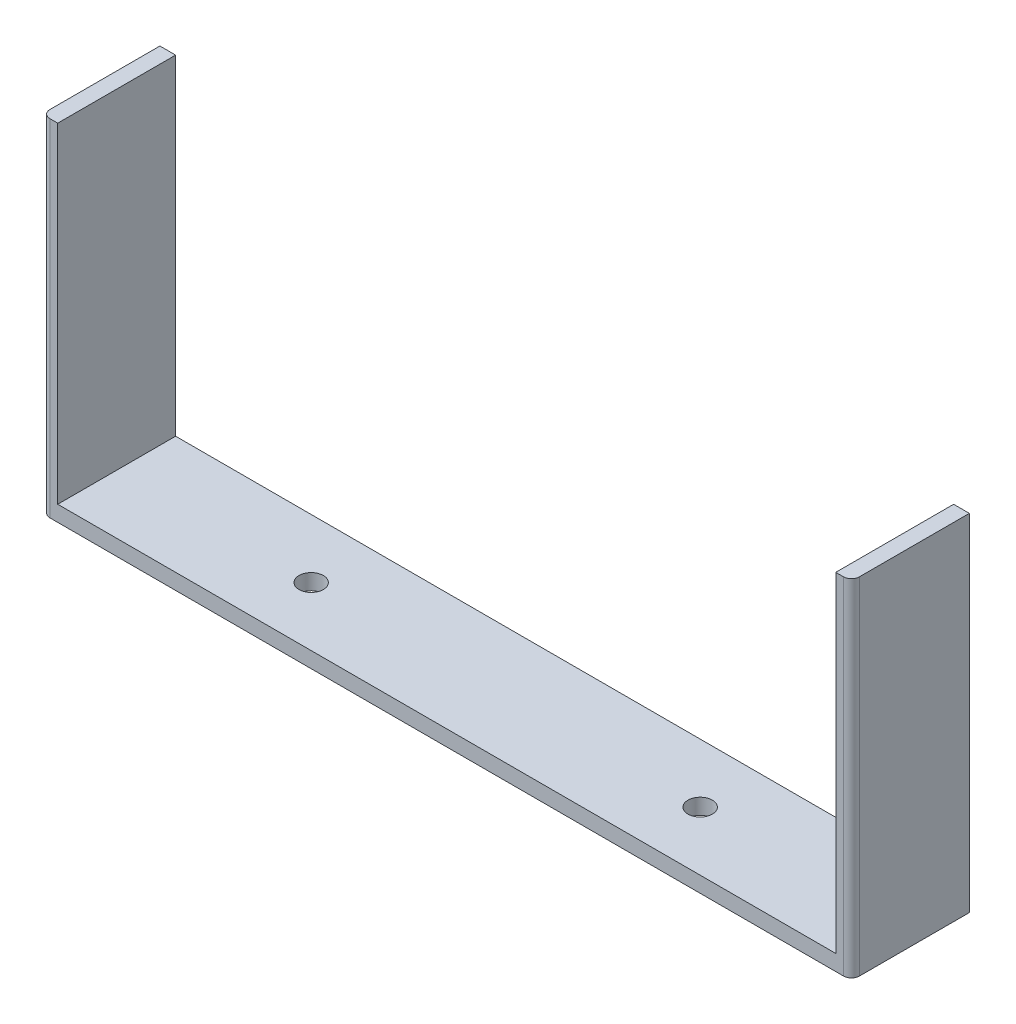
from build123d import *

# Parameters (mm, degrees)
ESBO_O1_W                = 103
ESBO_O1_H                = 15
RESSALTO_EXTRUS_O1_DEPTH = 2
ESBO_O2_W                = 2
ESBO_O2_H                = 15
RESSALTO_EXTRUS_O2_DEPTH = 42
ESBO_O4_R                = 1.55
CORTE_EXTRUS_O1_DEPTH    = 2
FILETE1_R                = 1


with BuildPart() as part:
    # Esboço1 → Ressalto-extrusão1 (new body)
    with BuildSketch(Plane(origin=(0, 0, 0), x_dir=(1, 0, 0), z_dir=(0, 1, 0))):
        Rectangle(ESBO_O1_W, ESBO_O1_H)
    extrude(amount=-RESSALTO_EXTRUS_O1_DEPTH)

    # Esboço2 → Ressalto-extrusão2 (add)
    with BuildSketch(Plane(origin=(0, 0, 0), x_dir=(1, 0, 0), z_dir=(0, 1, 0))):
        with Locations((-50.5, 0)):
            Rectangle(ESBO_O2_W, ESBO_O2_H)
        with Locations((50.5, 0)):
            Rectangle(ESBO_O2_W, ESBO_O2_H)
    extrude(amount=RESSALTO_EXTRUS_O2_DEPTH)

    # Esboço4 → Corte-extrusão1 (cut)
    with BuildSketch(Plane(origin=(0, 0, 0), x_dir=(1, 0, 0), z_dir=(0, 1, 0))):
        with Locations((24.75, 0)):
            Circle(ESBO_O4_R)
        with Locations((-24.75, 0)):
            Circle(ESBO_O4_R)
    extrude(amount=-CORTE_EXTRUS_O1_DEPTH, mode=Mode.SUBTRACT)

    # Filete1
    filete1_edges = [part.edges().sort_by_distance(p)[0] for p in [
        (51.5, 20, 7.5),
        (-51.5, 20, 7.5),
    ]]
    fillet(filete1_edges, radius=FILETE1_R)


solid = part.part
